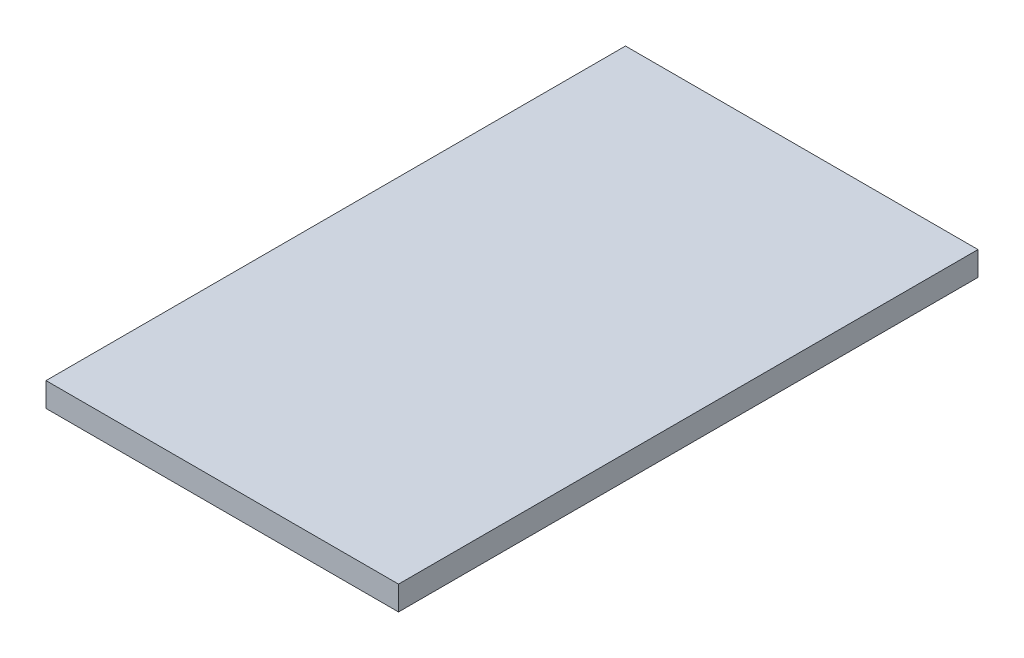
from build123d import *

# Parameters (mm, degrees)
SKETCH1_W           = 73
SKETCH1_H           = 120
BOSS_EXTRUDE1_DEPTH = 5


with BuildPart() as part:
    # Sketch1 → Boss-Extrude1 (new body)
    with BuildSketch(Plane(origin=(0, 0, 0), x_dir=(1, 0, 0), z_dir=(0, 1, 0))):
        Rectangle(SKETCH1_W, SKETCH1_H)
    extrude(amount=BOSS_EXTRUDE1_DEPTH)


solid = part.part
